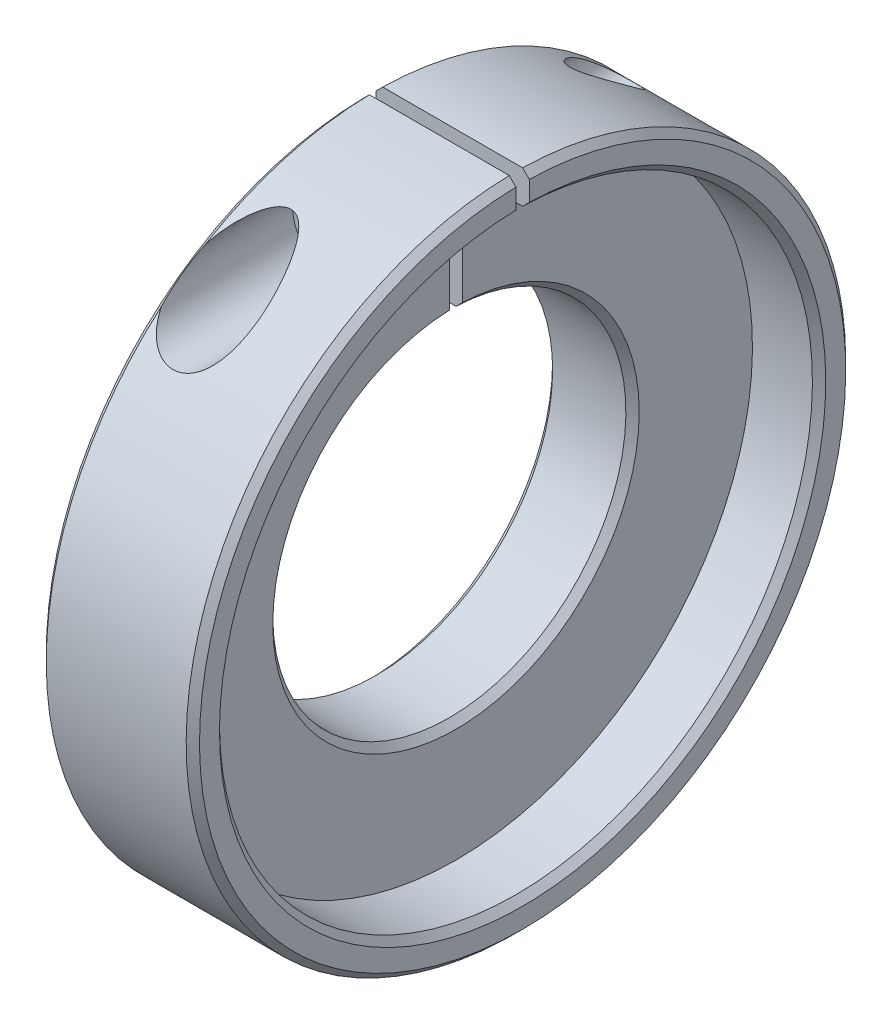
from build123d import *

# Parameters (mm, degrees)
ESQUISSE2_W                  = 1
ESQUISSE2_H                  = 24.75
ENL_V_MAT_EXTRU_1_DEPTH      = 37.842570486
ENL_V_MAT_EXTRU_2_DEPTH      = 36.600210674
ENL_V_MAT_EXTRU_2_DEPTH_BACK = 36.600210674
ESQUISSE3_R                  = 1.75
ESQUISSE4_W                  = 11.987843117
ESQUISSE4_H                  = 3
CHANFREIN1_SIZE              = 0.5
ESQUISSE5_R                  = 2.05
ENL_V_MAT_EXTRU_3_DEPTH      = 36.949617679


with BuildPart() as part:
    # Esquisse1 → Révolution1 (revolve)
    with BuildSketch(Plane.XY, mode=Mode.PRIVATE) as r_volution1_sk:
        Polygon((0, 13.25), (-6.5, 13.25), (-6.5, 24.75), (5, 24.75), (5, 22.25), (0, 22.25), align=None)
    revolve(r_volution1_sk.sketch.rotate(Axis((0, 0, 0), (-1, 0, 0)), 90), axis=Axis((0, 0, 0), (-1, 0, 0)))

    # Esquisse2 → Enlèv. mat.-Extru.1 (cut, through all)
    with BuildSketch(Plane(origin=(5, 0, 0), x_dir=(0, 0, -1), z_dir=(1, 0, 0))):
        with Locations((0, 12.375)):
            Rectangle(ESQUISSE2_W, ESQUISSE2_H)
    extrude(amount=-ENL_V_MAT_EXTRU_1_DEPTH, mode=Mode.SUBTRACT)

    # Esquisse3 → Enlèv. mat.-Extru.2 (cut, two sides: drawn at the far end of the back side and taken through both)
    with BuildSketch(Plane.XY.offset(-ENL_V_MAT_EXTRU_2_DEPTH_BACK)):
        with Locations((-3.25, 20)):
            Circle(ESQUISSE3_R)
    extrude(amount=ENL_V_MAT_EXTRU_2_DEPTH + ENL_V_MAT_EXTRU_2_DEPTH_BACK, mode=Mode.SUBTRACT)

    # Esquisse4 → Enlèvement de matière-Révolution1 (revolve, cut)
    with BuildSketch(Plane.ZY.offset(3.25), mode=Mode.PRIVATE) as enl_vement_de_mati_re_r_volution1_sk:
        with Locations((11.993921559, 18.5)):
            Rectangle(ESQUISSE4_W, ESQUISSE4_H)
    revolve(enl_vement_de_mati_re_r_volution1_sk.sketch.rotate(Axis((-3.25, 20, 6), (0, 0, -1)), 270), axis=Axis((-3.25, 20, 6), (0, 0, -1)), mode=Mode.SUBTRACT)

    # Chanfrein1
    # the kernel refuses this chamfer: 0.5 mm, written as the material it takes off along each edge
    with BuildSketch(Plane(origin=(5, 0, 0), x_dir=(0, 0, -1), z_dir=(0, 1, 0))) as chanfrein1_piece_1:
        Polygon((22.25, CHANFREIN1_SIZE), (22.25 + CHANFREIN1_SIZE, 0), (22.25, 0), align=None)
    chanfrein1_piece_1_solid = revolve(axis=Axis((5, 0, 0), (-1, 0, 0)), revolution_arc=272.035388743, mode=Mode.PRIVATE)
    with BuildSketch(Plane(origin=(5, 0, 0), x_dir=(0, 0, -1), z_dir=(0, 1, 0))) as chanfrein1_piece_2:
        Polygon((24.75, CHANFREIN1_SIZE), (24.75 - CHANFREIN1_SIZE, 0), (24.75, 0), align=None)
    chanfrein1_piece_2_solid = revolve(axis=Axis((5, 0, 0), (-1, 0, 0)), revolution_arc=271.829822987, mode=Mode.PRIVATE)
    with BuildSketch(Plane(origin=(-6.5, 0, 0), x_dir=(0, 0, -1), z_dir=(0, 1, 0))) as chanfrein1_piece_3:
        Polygon((24.75, -CHANFREIN1_SIZE), (24.75 - CHANFREIN1_SIZE, 0), (24.75, 0), align=None)
    chanfrein1_piece_3_solid = revolve(axis=Axis((-6.5, 0, 0), (-1, 0, 0)), revolution_arc=271.829822987, mode=Mode.PRIVATE)
    with BuildSketch(Plane(origin=(0, 0, 0), x_dir=(0, 0, -1), z_dir=(0, 1, 0))) as chanfrein1_piece_4:
        Polygon((13.25, CHANFREIN1_SIZE), (13.25 + CHANFREIN1_SIZE, 0), (13.25, 0), align=None)
    chanfrein1_piece_4_solid = revolve(axis=Axis((0, 0, 0), (-1, 0, 0)), revolution_arc=273.417455425, mode=Mode.PRIVATE)
    with BuildSketch(Plane(origin=(-6.5, 0, 0), x_dir=(0, 0, -1), z_dir=(0, 1, 0))) as chanfrein1_piece_5:
        Polygon((13.25, -CHANFREIN1_SIZE), (13.25 + CHANFREIN1_SIZE, 0), (13.25, 0), align=None)
    chanfrein1_piece_5_solid = revolve(axis=Axis((-6.5, 0, 0), (-1, 0, 0)), revolution_arc=273.417455425, mode=Mode.PRIVATE)
    with BuildSketch(Plane(origin=(-6.5, 0, 0), x_dir=(0, 0.9982400789051599, 0.059302148927506945), z_dir=(0, -0.059302148927506945, 0.9982400789051599))) as chanfrein1_piece_6:
        Polygon((13.25, -CHANFREIN1_SIZE), (13.25 + CHANFREIN1_SIZE, 0), (13.25, 0), align=None)
    chanfrein1_piece_6_solid = revolve(axis=Axis((-6.5, 0, 0), (-1, 0, 0)), revolution_arc=93.399757519, mode=Mode.PRIVATE)
    with BuildSketch(Plane(origin=(0, 0, 0), x_dir=(0, 0.9982400789051599, 0.059302148927506945), z_dir=(0, -0.059302148927506945, 0.9982400789051599))) as chanfrein1_piece_7:
        Polygon((13.25 + CHANFREIN1_SIZE, 0), (13.25, CHANFREIN1_SIZE), (13.25, 0), align=None)
    chanfrein1_piece_7_solid = revolve(axis=Axis((0, 0, 0), (-1, 0, 0)), revolution_arc=93.399757519, mode=Mode.PRIVATE)
    with BuildSketch(Plane(origin=(-6.5, 0, 0), x_dir=(0, 0.9994953717545437, 0.0317647893310561), z_dir=(0, -0.0317647893310561, 0.9994953717545437))) as chanfrein1_piece_8:
        Polygon((24.75, -CHANFREIN1_SIZE), (24.75 - CHANFREIN1_SIZE, 0), (24.75, 0), align=None)
    chanfrein1_piece_8_solid = revolve(axis=Axis((-6.5, 0, 0), (-1, 0, 0)), revolution_arc=91.820294567, mode=Mode.PRIVATE)
    with BuildSketch(Plane(origin=(5, 0, 0), x_dir=(0, 0.9994953717545433, 0.03176478933106764), z_dir=(0, -0.03176478933106764, 0.9994953717545433))) as chanfrein1_piece_9:
        Polygon((24.75, CHANFREIN1_SIZE), (24.75 - CHANFREIN1_SIZE, 0), (24.75, 0), align=None)
    chanfrein1_piece_9_solid = revolve(axis=Axis((5, 0, 0), (-1, 0, 0)), revolution_arc=91.820294567, mode=Mode.PRIVATE)
    with BuildSketch(Plane(origin=(5, 0, 0), x_dir=(0, 0.9993756290126987, 0.03533202705015153), z_dir=(0, -0.03533202705015153, 0.9993756290126987))) as chanfrein1_piece_10:
        Polygon((22.25, CHANFREIN1_SIZE), (22.25 + CHANFREIN1_SIZE, 0), (22.25, 0), align=None)
    chanfrein1_piece_10_solid = revolve(axis=Axis((5, 0, 0), (-1, 0, 0)), revolution_arc=92.024797457, mode=Mode.PRIVATE)
    add([chanfrein1_piece_1_solid, chanfrein1_piece_2_solid, chanfrein1_piece_3_solid, chanfrein1_piece_4_solid, chanfrein1_piece_5_solid, chanfrein1_piece_6_solid, chanfrein1_piece_7_solid, chanfrein1_piece_8_solid, chanfrein1_piece_9_solid, chanfrein1_piece_10_solid], mode=Mode.SUBTRACT)

    # Esquisse5 → Enlèv. mat.-Extru.3 (cut, through all)
    with BuildSketch(Plane(origin=(0, 0, 0.5), x_dir=(-1, 0, 0), z_dir=(0, 0, -1))):
        with Locations((3.25, 20)):
            Circle(ESQUISSE5_R)
    extrude(amount=-ENL_V_MAT_EXTRU_3_DEPTH, mode=Mode.SUBTRACT)


solid = part.part
